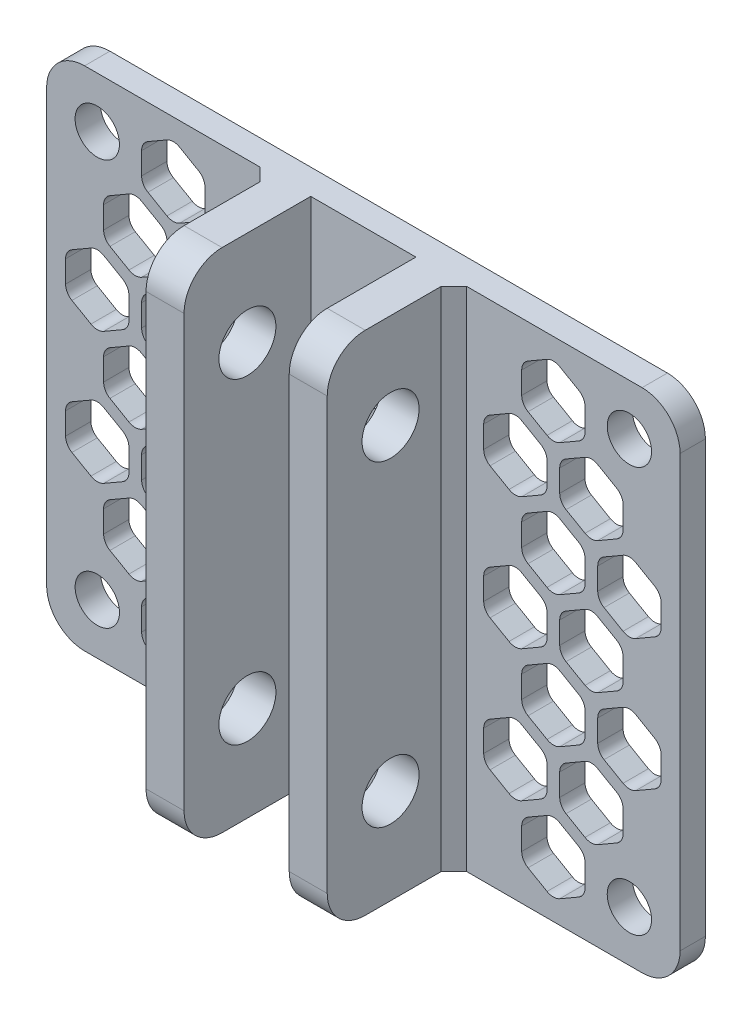
from build123d import *

# Parameters (mm, degrees)
ESQUISSE1_W                     = 50
ESQUISSE1_H                     = 40
ESQUISSE1_R                     = 1.75
BOSS_EXTRU_1_DEPTH              = 2
ESQUISSE2_W                     = 3
ESQUISSE2_H                     = 40
BOSS_EXTRU_2_DEPTH              = 10
ENL_V_MAT_EXTRU_1_DEPTH         = 53.703154555
ENL_V_MAT_EXTRU_1_DEPTH_BACK    = 53.703154555
ESQUISSE3_R                     = 2.25
CONG_1_R                        = 3
ENL_V_MAT_EXTRU_2_DEPTH         = 66.1459899
ENL_V_MAT_EXTRU_2_DEPTH_BACK    = 66.1459899
R_P_TITION_DANS_UNE_ZONE1_DEPTH = 2
CHANFREIN1_SIZE                 = 1


# Read off the part's stored shape, not the designer's step: Répétition dans une zone1
with BuildPart() as part:
    # Esquisse1 → Boss.-Extru.1 (new body)
    with BuildSketch(Plane.XY):
        with Locations((25, 20)):
            Rectangle(ESQUISSE1_W, ESQUISSE1_H)
        with Locations((4, 4)):
            Circle(ESQUISSE1_R, mode=Mode.SUBTRACT)
        with Locations(Location((46, 4, 0), (0, 0, 180))):
            Circle(ESQUISSE1_R, mode=Mode.SUBTRACT)
        with Locations((46, 36)):
            Circle(ESQUISSE1_R, mode=Mode.SUBTRACT)
        with Locations(Location((4, 36, 0), (0, 0, 180))):
            Circle(ESQUISSE1_R, mode=Mode.SUBTRACT)
    extrude(amount=BOSS_EXTRU_1_DEPTH)

    # Esquisse2 → Boss.-Extru.2 (add)
    with BuildSketch(Plane.XY.offset(2)):
        with Locations((19.35, 20)):
            Rectangle(ESQUISSE2_W, ESQUISSE2_H)
        with Locations((30.65, 20)):
            Rectangle(ESQUISSE2_W, ESQUISSE2_H)
    extrude(amount=BOSS_EXTRU_2_DEPTH)

    # Esquisse3 → Enlèv. mat.-Extru.1 (cut, two sides: drawn at the far end of the back side and taken through both)
    with BuildSketch(Plane.ZY.offset(-17.85).offset(-ENL_V_MAT_EXTRU_1_DEPTH_BACK)):
        with Locations((7, 32.5)):
            Circle(ESQUISSE3_R)
        with Locations((7, 7.5)):
            Circle(ESQUISSE3_R)
    extrude(amount=ENL_V_MAT_EXTRU_1_DEPTH + ENL_V_MAT_EXTRU_1_DEPTH_BACK, mode=Mode.SUBTRACT)

    # Congé1
    cong_1_edges = [part.edges().sort_by_distance(p)[0] for p in [
        (19.35, 0, 12),
        (19.35, 40, 12),
        (30.65, 40, 12),
        (30.65, 0, 12),
        (0, 40, 1),
        (50, 40, 1),
        (50, 0, 1),
        (0, 0, 1),
    ]]
    fillet(cong_1_edges, radius=CONG_1_R)

    # Esquisse4 → Enlèv. mat.-Extru.2 (cut, two sides: drawn at the far end of the back side and taken through both)
    with BuildSketch(Plane(origin=(0, 0, 0), x_dir=(-1, 0, 0), z_dir=(0, 0, -1)).offset(-ENL_V_MAT_EXTRU_2_DEPTH_BACK)):
        with BuildLine():
            Line((-22.5, 19.133974596), (-22.5, 20.866025404))
            ThreePointArc((-22.5, 20.866025404), (-22.633974596, 21.366025404), (-23, 21.732050808))
            Line((-23, 21.732050808), (-24.5, 22.598076211))
            ThreePointArc((-24.5, 22.598076211), (-25, 22.732050808), (-25.5, 22.598076211))
            Line((-25.5, 22.598076211), (-27, 21.732050808))
            ThreePointArc((-27, 21.732050808), (-27.366025404, 21.366025404), (-27.5, 20.866025404))
            Line((-27.5, 20.866025404), (-27.5, 19.133974596))
            ThreePointArc((-27.5, 19.133974596), (-27.366025404, 18.633974596), (-27, 18.267949192))
            Line((-27, 18.267949192), (-25.5, 17.401923789))
            ThreePointArc((-25.5, 17.401923789), (-25, 17.267949192), (-24.5, 17.401923789))
            Line((-24.5, 17.401923789), (-23, 18.267949192))
            ThreePointArc((-23, 18.267949192), (-22.633974596, 18.633974596), (-22.5, 19.133974596))
        make_face()
    extrude(amount=ENL_V_MAT_EXTRU_2_DEPTH + ENL_V_MAT_EXTRU_2_DEPTH_BACK, mode=Mode.SUBTRACT)

    # Répétition dans une zone1 outline → Répétition dans une zone1 (cut)
    with BuildSketch(Plane.XY):
        with BuildLine():
            ThreePointArc((42.5, 27.794228634), (43, 27.660254038), (43.5, 27.794228634))
            Line((43.5, 27.794228634), (45, 28.660254038))
            ThreePointArc((45, 28.660254038), (45.366025404, 29.026279442), (45.5, 29.526279442))
            Line((45.5, 29.526279442), (45.5, 31.258330249))
            ThreePointArc((45.5, 31.258330249), (45.366025404, 31.758330249), (45, 32.124355653))
            Line((45, 32.124355653), (43.5, 32.990381057))
            ThreePointArc((43.5, 32.990381057), (43, 33.124355653), (42.5, 32.990381057))
            Line((42.5, 32.990381057), (41, 32.124355653))
            ThreePointArc((41, 32.124355653), (40.633974596, 31.758330249), (40.5, 31.258330249))
            Line((40.5, 31.258330249), (40.5, 29.526279442))
            ThreePointArc((40.5, 29.526279442), (40.633974596, 29.026279442), (41, 28.660254038))
            Line((41, 28.660254038), (42.5, 27.794228634))
        make_face()
        with BuildLine():
            ThreePointArc((6.5, 7.009618943), (7, 6.875644347), (7.5, 7.009618943))
            Line((7.5, 7.009618943), (9, 7.875644347))
            ThreePointArc((9, 7.875644347), (9.366025404, 8.241669751), (9.5, 8.741669751))
            Line((9.5, 8.741669751), (9.5, 10.473720558))
            ThreePointArc((9.5, 10.473720558), (9.366025404, 10.973720558), (9, 11.339745962))
            Line((9, 11.339745962), (7.5, 12.205771366))
            ThreePointArc((7.5, 12.205771366), (7, 12.339745962), (6.5, 12.205771366))
            Line((6.5, 12.205771366), (5, 11.339745962))
            ThreePointArc((5, 11.339745962), (4.633974596, 10.973720558), (4.5, 10.473720558))
            Line((4.5, 10.473720558), (4.5, 8.741669751))
            ThreePointArc((4.5, 8.741669751), (4.633974596, 8.241669751), (5, 7.875644347))
            Line((5, 7.875644347), (6.5, 7.009618943))
        make_face()
        with BuildLine():
            ThreePointArc((27, 28.660254038), (27.366025404, 29.026279442), (27.5, 29.526279442))
            Line((27.5, 29.526279442), (27.5, 31.258330249))
            ThreePointArc((27.5, 31.258330249), (27.366025404, 31.758330249), (27, 32.124355653))
            Line((27, 32.124355653), (25.5, 32.990381057))
            ThreePointArc((25.5, 32.990381057), (25, 33.124355653), (24.5, 32.990381057))
            Line((24.5, 32.990381057), (23, 32.124355653))
            ThreePointArc((23, 32.124355653), (22.633974596, 31.758330249), (22.5, 31.258330249))
            Line((22.5, 31.258330249), (22.5, 29.526279442))
            ThreePointArc((22.5, 29.526279442), (22.633974596, 29.026279442), (23, 28.660254038))
            Line((23, 28.660254038), (24.5, 27.794228634))
            ThreePointArc((24.5, 27.794228634), (25, 27.660254038), (25.5, 27.794228634))
            Line((25.5, 27.794228634), (27, 28.660254038))
        make_face()
        with BuildLine():
            ThreePointArc((27, 7.875644347), (27.366025404, 8.241669751), (27.5, 8.741669751))
            Line((27.5, 8.741669751), (27.5, 10.473720558))
            ThreePointArc((27.5, 10.473720558), (27.366025404, 10.973720558), (27, 11.339745962))
            Line((27, 11.339745962), (25.5, 12.205771366))
            ThreePointArc((25.5, 12.205771366), (25, 12.339745962), (24.5, 12.205771366))
            Line((24.5, 12.205771366), (23, 11.339745962))
            ThreePointArc((23, 11.339745962), (22.633974596, 10.973720558), (22.5, 10.473720558))
            Line((22.5, 10.473720558), (22.5, 8.741669751))
            ThreePointArc((22.5, 8.741669751), (22.633974596, 8.241669751), (23, 7.875644347))
            Line((23, 7.875644347), (24.5, 7.009618943))
            ThreePointArc((24.5, 7.009618943), (25, 6.875644347), (25.5, 7.009618943))
            Line((25.5, 7.009618943), (27, 7.875644347))
        make_face()
        with BuildLine():
            ThreePointArc((45.5, 10.473720558), (45.366025404, 10.973720558), (45, 11.339745962))
            Line((45, 11.339745962), (43.5, 12.205771366))
            ThreePointArc((43.5, 12.205771366), (43, 12.339745962), (42.5, 12.205771366))
            Line((42.5, 12.205771366), (41, 11.339745962))
            ThreePointArc((41, 11.339745962), (40.633974596, 10.973720558), (40.5, 10.473720558))
            Line((40.5, 10.473720558), (40.5, 8.741669751))
            ThreePointArc((40.5, 8.741669751), (40.633974596, 8.241669751), (41, 7.875644347))
            Line((41, 7.875644347), (42.5, 7.009618943))
            ThreePointArc((42.5, 7.009618943), (43, 6.875644347), (43.5, 7.009618943))
            Line((43.5, 7.009618943), (45, 7.875644347))
            ThreePointArc((45, 7.875644347), (45.366025404, 8.241669751), (45.5, 8.741669751))
            Line((45.5, 8.741669751), (45.5, 10.473720558))
        make_face()
        with BuildLine():
            ThreePointArc((9.5, 31.258330249), (9.366025404, 31.758330249), (9, 32.124355653))
            Line((9, 32.124355653), (7.5, 32.990381057))
            ThreePointArc((7.5, 32.990381057), (7, 33.124355653), (6.5, 32.990381057))
            Line((6.5, 32.990381057), (5, 32.124355653))
            ThreePointArc((5, 32.124355653), (4.633974596, 31.758330249), (4.5, 31.258330249))
            Line((4.5, 31.258330249), (4.5, 29.526279442))
            ThreePointArc((4.5, 29.526279442), (4.633974596, 29.026279442), (5, 28.660254038))
            Line((5, 28.660254038), (6.5, 27.794228634))
            ThreePointArc((6.5, 27.794228634), (7, 27.660254038), (7.5, 27.794228634))
            Line((7.5, 27.794228634), (9, 28.660254038))
            ThreePointArc((9, 28.660254038), (9.366025404, 29.026279442), (9.5, 29.526279442))
            Line((9.5, 29.526279442), (9.5, 31.258330249))
        make_face()
        with BuildLine():
            ThreePointArc((45.5, 22.598076211), (46, 22.464101615), (46.5, 22.598076211))
            Line((46.5, 22.598076211), (48, 23.464101615))
            ThreePointArc((48, 23.464101615), (48.366025404, 23.830127019), (48.5, 24.330127019))
            Line((48.5, 24.330127019), (48.5, 26.062177826))
            ThreePointArc((48.5, 26.062177826), (48.366025404, 26.562177826), (48, 26.92820323))
            Line((48, 26.92820323), (46.5, 27.794228634))
            ThreePointArc((46.5, 27.794228634), (46, 27.92820323), (45.5, 27.794228634))
            Line((45.5, 27.794228634), (44, 26.92820323))
            ThreePointArc((44, 26.92820323), (43.633974596, 26.562177826), (43.5, 26.062177826))
            Line((43.5, 26.062177826), (43.5, 24.330127019))
            ThreePointArc((43.5, 24.330127019), (43.633974596, 23.830127019), (44, 23.464101615))
            Line((44, 23.464101615), (45.5, 22.598076211))
        make_face()
        with BuildLine():
            ThreePointArc((36.5, 17.401923789), (37, 17.267949192), (37.5, 17.401923789))
            Line((37.5, 17.401923789), (39, 18.267949192))
            ThreePointArc((39, 18.267949192), (39.366025404, 18.633974596), (39.5, 19.133974596))
            Line((39.5, 19.133974596), (39.5, 20.866025404))
            ThreePointArc((39.5, 20.866025404), (39.366025404, 21.366025404), (39, 21.732050808))
            Line((39, 21.732050808), (37.5, 22.598076211))
            ThreePointArc((37.5, 22.598076211), (37, 22.732050808), (36.5, 22.598076211))
            Line((36.5, 22.598076211), (35, 21.732050808))
            ThreePointArc((35, 21.732050808), (34.633974596, 21.366025404), (34.5, 20.866025404))
            Line((34.5, 20.866025404), (34.5, 19.133974596))
            ThreePointArc((34.5, 19.133974596), (34.633974596, 18.633974596), (35, 18.267949192))
            Line((35, 18.267949192), (36.5, 17.401923789))
        make_face()
        with BuildLine():
            ThreePointArc((9.5, 1.813466521), (10, 1.679491924), (10.5, 1.813466521))
            Line((10.5, 1.813466521), (12, 2.679491924))
            ThreePointArc((12, 2.679491924), (12.366025404, 3.045517328), (12.5, 3.545517328))
            Line((12.5, 3.545517328), (12.5, 5.277568136))
            ThreePointArc((12.5, 5.277568136), (12.366025404, 5.777568136), (12, 6.143593539))
            Line((12, 6.143593539), (10.5, 7.009618943))
            ThreePointArc((10.5, 7.009618943), (10, 7.143593539), (9.5, 7.009618943))
            Line((9.5, 7.009618943), (8, 6.143593539))
            ThreePointArc((8, 6.143593539), (7.633974596, 5.777568136), (7.5, 5.277568136))
            Line((7.5, 5.277568136), (7.5, 3.545517328))
            ThreePointArc((7.5, 3.545517328), (7.633974596, 3.045517328), (8, 2.679491924))
            Line((8, 2.679491924), (9.5, 1.813466521))
        make_face()
        with BuildLine():
            ThreePointArc((48, 13.07179677), (48.366025404, 13.437822174), (48.5, 13.937822174))
            Line((48.5, 13.937822174), (48.5, 15.669872981))
            ThreePointArc((48.5, 15.669872981), (48.366025404, 16.169872981), (48, 16.535898385))
            Line((48, 16.535898385), (46.5, 17.401923789))
            ThreePointArc((46.5, 17.401923789), (46, 17.535898385), (45.5, 17.401923789))
            Line((45.5, 17.401923789), (44, 16.535898385))
            ThreePointArc((44, 16.535898385), (43.633974596, 16.169872981), (43.5, 15.669872981))
            Line((43.5, 15.669872981), (43.5, 13.937822174))
            ThreePointArc((43.5, 13.937822174), (43.633974596, 13.437822174), (44, 13.07179677))
            Line((44, 13.07179677), (45.5, 12.205771366))
            ThreePointArc((45.5, 12.205771366), (46, 12.07179677), (46.5, 12.205771366))
            Line((46.5, 12.205771366), (48, 13.07179677))
        make_face()
        with BuildLine():
            ThreePointArc((39.5, 31.258330249), (39.366025404, 31.758330249), (39, 32.124355653))
            Line((39, 32.124355653), (37.5, 32.990381057))
            ThreePointArc((37.5, 32.990381057), (37, 33.124355653), (36.5, 32.990381057))
            Line((36.5, 32.990381057), (35, 32.124355653))
            ThreePointArc((35, 32.124355653), (34.633974596, 31.758330249), (34.5, 31.258330249))
            Line((34.5, 31.258330249), (34.5, 29.526279442))
            ThreePointArc((34.5, 29.526279442), (34.633974596, 29.026279442), (35, 28.660254038))
            Line((35, 28.660254038), (36.5, 27.794228634))
            ThreePointArc((36.5, 27.794228634), (37, 27.660254038), (37.5, 27.794228634))
            Line((37.5, 27.794228634), (39, 28.660254038))
            ThreePointArc((39, 28.660254038), (39.366025404, 29.026279442), (39.5, 29.526279442))
            Line((39.5, 29.526279442), (39.5, 31.258330249))
        make_face()
        with BuildLine():
            ThreePointArc((39.5, 12.205771366), (40, 12.07179677), (40.5, 12.205771366))
            Line((40.5, 12.205771366), (42, 13.07179677))
            ThreePointArc((42, 13.07179677), (42.366025404, 13.437822174), (42.5, 13.937822174))
            Line((42.5, 13.937822174), (42.5, 15.669872981))
            ThreePointArc((42.5, 15.669872981), (42.366025404, 16.169872981), (42, 16.535898385))
            Line((42, 16.535898385), (40.5, 17.401923789))
            ThreePointArc((40.5, 17.401923789), (40, 17.535898385), (39.5, 17.401923789))
            Line((39.5, 17.401923789), (38, 16.535898385))
            ThreePointArc((38, 16.535898385), (37.633974596, 16.169872981), (37.5, 15.669872981))
            Line((37.5, 15.669872981), (37.5, 13.937822174))
            ThreePointArc((37.5, 13.937822174), (37.633974596, 13.437822174), (38, 13.07179677))
            Line((38, 13.07179677), (39.5, 12.205771366))
        make_face()
        with BuildLine():
            ThreePointArc((42, 2.679491924), (42.366025404, 3.045517328), (42.5, 3.545517328))
            Line((42.5, 3.545517328), (42.5, 5.277568136))
            ThreePointArc((42.5, 5.277568136), (42.366025404, 5.777568136), (42, 6.143593539))
            Line((42, 6.143593539), (40.5, 7.009618943))
            ThreePointArc((40.5, 7.009618943), (40, 7.143593539), (39.5, 7.009618943))
            Line((39.5, 7.009618943), (38, 6.143593539))
            ThreePointArc((38, 6.143593539), (37.633974596, 5.777568136), (37.5, 5.277568136))
            Line((37.5, 5.277568136), (37.5, 3.545517328))
            ThreePointArc((37.5, 3.545517328), (37.633974596, 3.045517328), (38, 2.679491924))
            Line((38, 2.679491924), (39.5, 1.813466521))
            ThreePointArc((39.5, 1.813466521), (40, 1.679491924), (40.5, 1.813466521))
            Line((40.5, 1.813466521), (42, 2.679491924))
        make_face()
        with BuildLine():
            ThreePointArc((42, 33.856406461), (42.366025404, 34.222431864), (42.5, 34.722431864))
            Line((42.5, 34.722431864), (42.5, 36.454482672))
            ThreePointArc((42.5, 36.454482672), (42.366025404, 36.954482672), (42, 37.320508076))
            Line((42, 37.320508076), (40.5, 38.186533479))
            ThreePointArc((40.5, 38.186533479), (40, 38.320508076), (39.5, 38.186533479))
            Line((39.5, 38.186533479), (38, 37.320508076))
            ThreePointArc((38, 37.320508076), (37.633974596, 36.954482672), (37.5, 36.454482672))
            Line((37.5, 36.454482672), (37.5, 34.722431864))
            ThreePointArc((37.5, 34.722431864), (37.633974596, 34.222431864), (38, 33.856406461))
            Line((38, 33.856406461), (39.5, 32.990381057))
            ThreePointArc((39.5, 32.990381057), (40, 32.856406461), (40.5, 32.990381057))
            Line((40.5, 32.990381057), (42, 33.856406461))
        make_face()
        with BuildLine():
            ThreePointArc((42, 23.464101615), (42.366025404, 23.830127019), (42.5, 24.330127019))
            Line((42.5, 24.330127019), (42.5, 26.062177826))
            ThreePointArc((42.5, 26.062177826), (42.366025404, 26.562177826), (42, 26.92820323))
            Line((42, 26.92820323), (40.5, 27.794228634))
            ThreePointArc((40.5, 27.794228634), (40, 27.92820323), (39.5, 27.794228634))
            Line((39.5, 27.794228634), (38, 26.92820323))
            ThreePointArc((38, 26.92820323), (37.633974596, 26.562177826), (37.5, 26.062177826))
            Line((37.5, 26.062177826), (37.5, 24.330127019))
            ThreePointArc((37.5, 24.330127019), (37.633974596, 23.830127019), (38, 23.464101615))
            Line((38, 23.464101615), (39.5, 22.598076211))
            ThreePointArc((39.5, 22.598076211), (40, 22.464101615), (40.5, 22.598076211))
            Line((40.5, 22.598076211), (42, 23.464101615))
        make_face()
        with BuildLine():
            ThreePointArc((15.5, 31.258330249), (15.366025404, 31.758330249), (15, 32.124355653))
            Line((15, 32.124355653), (13.5, 32.990381057))
            ThreePointArc((13.5, 32.990381057), (13, 33.124355653), (12.5, 32.990381057))
            Line((12.5, 32.990381057), (11, 32.124355653))
            ThreePointArc((11, 32.124355653), (10.633974596, 31.758330249), (10.5, 31.258330249))
            Line((10.5, 31.258330249), (10.5, 29.526279442))
            ThreePointArc((10.5, 29.526279442), (10.633974596, 29.026279442), (11, 28.660254038))
            Line((11, 28.660254038), (12.5, 27.794228634))
            ThreePointArc((12.5, 27.794228634), (13, 27.660254038), (13.5, 27.794228634))
            Line((13.5, 27.794228634), (15, 28.660254038))
            ThreePointArc((15, 28.660254038), (15.366025404, 29.026279442), (15.5, 29.526279442))
            Line((15.5, 29.526279442), (15.5, 31.258330249))
        make_face()
        with BuildLine():
            ThreePointArc((39, 7.875644347), (39.366025404, 8.241669751), (39.5, 8.741669751))
            Line((39.5, 8.741669751), (39.5, 10.473720558))
            ThreePointArc((39.5, 10.473720558), (39.366025404, 10.973720558), (39, 11.339745962))
            Line((39, 11.339745962), (37.5, 12.205771366))
            ThreePointArc((37.5, 12.205771366), (37, 12.339745962), (36.5, 12.205771366))
            Line((36.5, 12.205771366), (35, 11.339745962))
            ThreePointArc((35, 11.339745962), (34.633974596, 10.973720558), (34.5, 10.473720558))
            Line((34.5, 10.473720558), (34.5, 8.741669751))
            ThreePointArc((34.5, 8.741669751), (34.633974596, 8.241669751), (35, 7.875644347))
            Line((35, 7.875644347), (36.5, 7.009618943))
            ThreePointArc((36.5, 7.009618943), (37, 6.875644347), (37.5, 7.009618943))
            Line((37.5, 7.009618943), (39, 7.875644347))
        make_face()
        with BuildLine():
            ThreePointArc((12.5, 36.454482672), (12.366025404, 36.954482672), (12, 37.320508076))
            Line((12, 37.320508076), (10.5, 38.186533479))
            ThreePointArc((10.5, 38.186533479), (10, 38.320508076), (9.5, 38.186533479))
            Line((9.5, 38.186533479), (8, 37.320508076))
            ThreePointArc((8, 37.320508076), (7.633974596, 36.954482672), (7.5, 36.454482672))
            Line((7.5, 36.454482672), (7.5, 34.722431864))
            ThreePointArc((7.5, 34.722431864), (7.633974596, 34.222431864), (8, 33.856406461))
            Line((8, 33.856406461), (9.5, 32.990381057))
            ThreePointArc((9.5, 32.990381057), (10, 32.856406461), (10.5, 32.990381057))
            Line((10.5, 32.990381057), (12, 33.856406461))
            ThreePointArc((12, 33.856406461), (12.366025404, 34.222431864), (12.5, 34.722431864))
            Line((12.5, 34.722431864), (12.5, 36.454482672))
        make_face()
        with BuildLine():
            ThreePointArc((45, 18.267949192), (45.366025404, 18.633974596), (45.5, 19.133974596))
            Line((45.5, 19.133974596), (45.5, 20.866025404))
            ThreePointArc((45.5, 20.866025404), (45.366025404, 21.366025404), (45, 21.732050808))
            Line((45, 21.732050808), (43.5, 22.598076211))
            ThreePointArc((43.5, 22.598076211), (43, 22.732050808), (42.5, 22.598076211))
            Line((42.5, 22.598076211), (41, 21.732050808))
            ThreePointArc((41, 21.732050808), (40.633974596, 21.366025404), (40.5, 20.866025404))
            Line((40.5, 20.866025404), (40.5, 19.133974596))
            ThreePointArc((40.5, 19.133974596), (40.633974596, 18.633974596), (41, 18.267949192))
            Line((41, 18.267949192), (42.5, 17.401923789))
            ThreePointArc((42.5, 17.401923789), (43, 17.267949192), (43.5, 17.401923789))
            Line((43.5, 17.401923789), (45, 18.267949192))
        make_face()
        with BuildLine():
            ThreePointArc((6.5, 17.401923789), (7, 17.267949192), (7.5, 17.401923789))
            Line((7.5, 17.401923789), (9, 18.267949192))
            ThreePointArc((9, 18.267949192), (9.366025404, 18.633974596), (9.5, 19.133974596))
            Line((9.5, 19.133974596), (9.5, 20.866025404))
            ThreePointArc((9.5, 20.866025404), (9.366025404, 21.366025404), (9, 21.732050808))
            Line((9, 21.732050808), (7.5, 22.598076211))
            ThreePointArc((7.5, 22.598076211), (7, 22.732050808), (6.5, 22.598076211))
            Line((6.5, 22.598076211), (5, 21.732050808))
            ThreePointArc((5, 21.732050808), (4.633974596, 21.366025404), (4.5, 20.866025404))
            Line((4.5, 20.866025404), (4.5, 19.133974596))
            ThreePointArc((4.5, 19.133974596), (4.633974596, 18.633974596), (5, 18.267949192))
            Line((5, 18.267949192), (6.5, 17.401923789))
        make_face()
        with BuildLine():
            ThreePointArc((12.5, 26.062177826), (12.366025404, 26.562177826), (12, 26.92820323))
            Line((12, 26.92820323), (10.5, 27.794228634))
            ThreePointArc((10.5, 27.794228634), (10, 27.92820323), (9.5, 27.794228634))
            Line((9.5, 27.794228634), (8, 26.92820323))
            ThreePointArc((8, 26.92820323), (7.633974596, 26.562177826), (7.5, 26.062177826))
            Line((7.5, 26.062177826), (7.5, 24.330127019))
            ThreePointArc((7.5, 24.330127019), (7.633974596, 23.830127019), (8, 23.464101615))
            Line((8, 23.464101615), (9.5, 22.598076211))
            ThreePointArc((9.5, 22.598076211), (10, 22.464101615), (10.5, 22.598076211))
            Line((10.5, 22.598076211), (12, 23.464101615))
            ThreePointArc((12, 23.464101615), (12.366025404, 23.830127019), (12.5, 24.330127019))
            Line((12.5, 24.330127019), (12.5, 26.062177826))
        make_face()
        with BuildLine():
            ThreePointArc((6.5, 26.062177826), (6.366025404, 26.562177826), (6, 26.92820323))
            Line((6, 26.92820323), (4.5, 27.794228634))
            ThreePointArc((4.5, 27.794228634), (4, 27.92820323), (3.5, 27.794228634))
            Line((3.5, 27.794228634), (2, 26.92820323))
            ThreePointArc((2, 26.92820323), (1.633974596, 26.562177826), (1.5, 26.062177826))
            Line((1.5, 26.062177826), (1.5, 24.330127019))
            ThreePointArc((1.5, 24.330127019), (1.633974596, 23.830127019), (2, 23.464101615))
            Line((2, 23.464101615), (3.5, 22.598076211))
            ThreePointArc((3.5, 22.598076211), (4, 22.464101615), (4.5, 22.598076211))
            Line((4.5, 22.598076211), (6, 23.464101615))
            ThreePointArc((6, 23.464101615), (6.366025404, 23.830127019), (6.5, 24.330127019))
            Line((6.5, 24.330127019), (6.5, 26.062177826))
        make_face()
        with BuildLine():
            ThreePointArc((15.5, 20.866025404), (15.366025404, 21.366025404), (15, 21.732050808))
            Line((15, 21.732050808), (13.5, 22.598076211))
            ThreePointArc((13.5, 22.598076211), (13, 22.732050808), (12.5, 22.598076211))
            Line((12.5, 22.598076211), (11, 21.732050808))
            ThreePointArc((11, 21.732050808), (10.633974596, 21.366025404), (10.5, 20.866025404))
            Line((10.5, 20.866025404), (10.5, 19.133974596))
            ThreePointArc((10.5, 19.133974596), (10.633974596, 18.633974596), (11, 18.267949192))
            Line((11, 18.267949192), (12.5, 17.401923789))
            ThreePointArc((12.5, 17.401923789), (13, 17.267949192), (13.5, 17.401923789))
            Line((13.5, 17.401923789), (15, 18.267949192))
            ThreePointArc((15, 18.267949192), (15.366025404, 18.633974596), (15.5, 19.133974596))
            Line((15.5, 19.133974596), (15.5, 20.866025404))
        make_face()
        with BuildLine():
            ThreePointArc((3.5, 12.205771366), (4, 12.07179677), (4.5, 12.205771366))
            Line((4.5, 12.205771366), (6, 13.07179677))
            ThreePointArc((6, 13.07179677), (6.366025404, 13.437822174), (6.5, 13.937822174))
            Line((6.5, 13.937822174), (6.5, 15.669872981))
            ThreePointArc((6.5, 15.669872981), (6.366025404, 16.169872981), (6, 16.535898385))
            Line((6, 16.535898385), (4.5, 17.401923789))
            ThreePointArc((4.5, 17.401923789), (4, 17.535898385), (3.5, 17.401923789))
            Line((3.5, 17.401923789), (2, 16.535898385))
            ThreePointArc((2, 16.535898385), (1.633974596, 16.169872981), (1.5, 15.669872981))
            Line((1.5, 15.669872981), (1.5, 13.937822174))
            ThreePointArc((1.5, 13.937822174), (1.633974596, 13.437822174), (2, 13.07179677))
            Line((2, 13.07179677), (3.5, 12.205771366))
        make_face()
        with BuildLine():
            ThreePointArc((12.5, 7.009618943), (13, 6.875644347), (13.5, 7.009618943))
            Line((13.5, 7.009618943), (15, 7.875644347))
            ThreePointArc((15, 7.875644347), (15.366025404, 8.241669751), (15.5, 8.741669751))
            Line((15.5, 8.741669751), (15.5, 10.473720558))
            ThreePointArc((15.5, 10.473720558), (15.366025404, 10.973720558), (15, 11.339745962))
            Line((15, 11.339745962), (13.5, 12.205771366))
            ThreePointArc((13.5, 12.205771366), (13, 12.339745962), (12.5, 12.205771366))
            Line((12.5, 12.205771366), (11, 11.339745962))
            ThreePointArc((11, 11.339745962), (10.633974596, 10.973720558), (10.5, 10.473720558))
            Line((10.5, 10.473720558), (10.5, 8.741669751))
            ThreePointArc((10.5, 8.741669751), (10.633974596, 8.241669751), (11, 7.875644347))
            Line((11, 7.875644347), (12.5, 7.009618943))
        make_face()
        with BuildLine():
            ThreePointArc((9.5, 12.205771366), (10, 12.07179677), (10.5, 12.205771366))
            Line((10.5, 12.205771366), (12, 13.07179677))
            ThreePointArc((12, 13.07179677), (12.366025404, 13.437822174), (12.5, 13.937822174))
            Line((12.5, 13.937822174), (12.5, 15.669872981))
            ThreePointArc((12.5, 15.669872981), (12.366025404, 16.169872981), (12, 16.535898385))
            Line((12, 16.535898385), (10.5, 17.401923789))
            ThreePointArc((10.5, 17.401923789), (10, 17.535898385), (9.5, 17.401923789))
            Line((9.5, 17.401923789), (8, 16.535898385))
            ThreePointArc((8, 16.535898385), (7.633974596, 16.169872981), (7.5, 15.669872981))
            Line((7.5, 15.669872981), (7.5, 13.937822174))
            ThreePointArc((7.5, 13.937822174), (7.633974596, 13.437822174), (8, 13.07179677))
            Line((8, 13.07179677), (9.5, 12.205771366))
        make_face()
    extrude(amount=R_P_TITION_DANS_UNE_ZONE1_DEPTH, mode=Mode.SUBTRACT)

    # Chanfrein1
    chanfrein1_edges = [part.edges().sort_by_distance(p)[0] for p in [
        (17.85, 20, 2),
        (32.15, 20, 2),
    ]]
    chamfer(chanfrein1_edges, length=CHANFREIN1_SIZE)


solid = part.part
